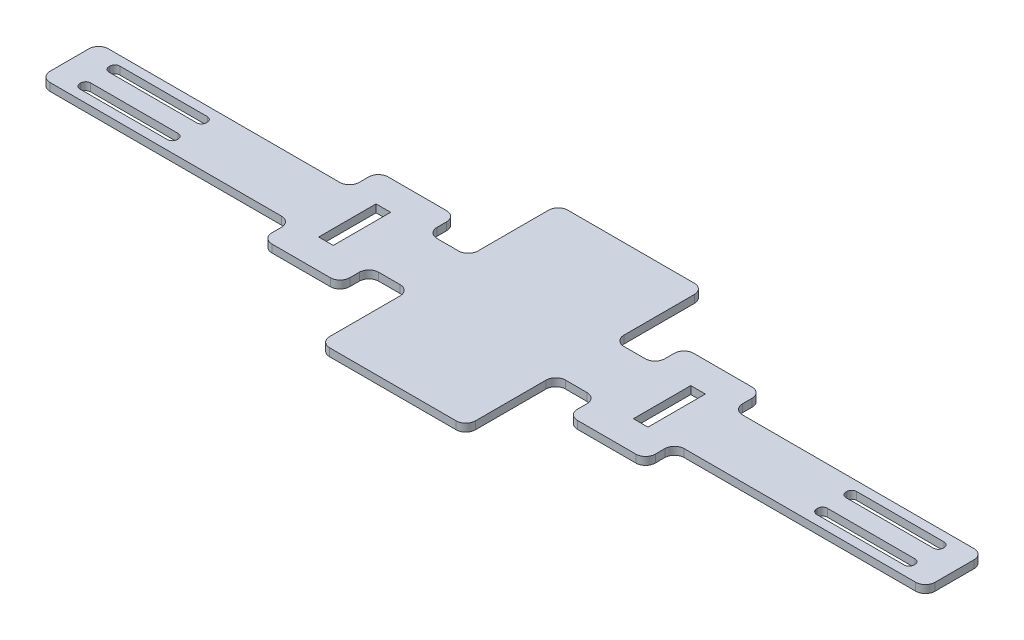
from build123d import *

# Parameters (mm, degrees)
SKETCH_11_W             = 70
SKETCH_11_H             = 12
EXTRUDE_6_DEPTH         = 1.6
SKETCH_12_W             = 3
SKETCH_12_H             = 11.8
CUT_EXTRUDE_6_DEPTH     = 1.6
SKETCH_13_W             = 20
SKETCH_13_H             = 2.2
CUT_EXTRUDE_7_DEPTH     = 1.6
FILLET_1_R              = 1
FILLET_1_OF_MIRROR_15_R = 1
EXTRUDE_7_DEPTH         = 1.6
SKETCH_16_W             = 6
SKETCH_16_H             = 12
EXTRUDE_9_DEPTH         = 1.6
SKETCH_18_W             = 30
SKETCH_18_H             = 49
EXTRUDE_12_DEPTH        = 1.6
FILLET_3_R              = 2
MIRROR_24_OUTLINE_W     = 3
MIRROR_24_OUTLINE_H     = 11.8
MIRROR_24_DEPTH         = 1.6
FILLET_4_R              = 2


# Read off the part's stored shape, not the designer's step: 镜向24
with BuildPart() as part:
    # 草图11 → 凸台-拉伸6 (new body)
    with BuildSketch(Plane(origin=(0, 0, 0), x_dir=(1, 0, 0), z_dir=(0, 1, 0))):
        with Locations((-92.991102456, 0)):
            Rectangle(SKETCH_11_W, SKETCH_11_H)
    extrude(amount=EXTRUDE_6_DEPTH)

    # 草图12 → 切除-拉伸6 (cut)
    with BuildSketch(Plane(origin=(0, 1.6, 0), x_dir=(1, 0, 0), z_dir=(0, 1, 0))):
        with Locations((-69.350034459, 0)):
            Rectangle(SKETCH_12_W, SKETCH_12_H)
    extrude(amount=-CUT_EXTRUDE_6_DEPTH, mode=Mode.SUBTRACT)

    # 草图13 → 切除-拉伸7 (cut)
    with BuildSketch(Plane(origin=(0, 1.6, 0), x_dir=(1, 0, 0), z_dir=(0, 1, 0))):
        with Locations((-112.744310304, 3)):
            Rectangle(SKETCH_13_W, SKETCH_13_H)
    cut_extrude_7 = extrude(amount=-CUT_EXTRUDE_7_DEPTH, mode=Mode.SUBTRACT)

    # 圆角1
    fillet_1_edges = [part.edges().sort_by_distance(p)[0] for p in [
        (-122.744310304, 0.8, -1.9),
        (-122.744310304, 0.8, -4.1),
        (-102.744310304, 0.8, -4.1),
        (-102.744310304, 0.8, -1.9),
    ]]
    fillet(fillet_1_edges, radius=FILLET_1_R)

    # 镜向15: 切除-拉伸7 across plane
    add(cut_extrude_7.mirror(Plane(origin=(0, 0, 0), x_dir=(1, 0, 0), z_dir=(0, 0, -1))), mode=Mode.SUBTRACT)

    # 圆角1 of 镜向15
    fillet_1_of_mirror_15_edges = [part.edges().sort_by_distance(p)[0] for p in [
        (-122.744310304, 0.8, 1.9),
        (-122.744310304, 0.8, 4.1),
        (-102.744310304, 0.8, 4.1),
        (-102.744310304, 0.8, 1.9),
    ]]
    fillet(fillet_1_of_mirror_15_edges, radius=FILLET_1_OF_MIRROR_15_R)

    # 草图14 → 凸台-拉伸7 (add)
    with BuildSketch(Plane(origin=(0, 0, 0), x_dir=(1, 0, 0), z_dir=(0, 1, 0))):
        Polygon((-60.400975616, 6), (-60.400975616, 11.948069584), (-62.610711949, 11.948069584), (-76.405563985, 11.948069584), (-76.405563985, 6), (-74.195827651, 6), (-62.609356584, 6), align=None)
    extrude_7 = extrude(amount=EXTRUDE_7_DEPTH)

    # 镜向17: 凸台-拉伸7 across plane
    add(extrude_7.mirror(Plane(origin=(0, 0, 0), x_dir=(1, 0, 0), z_dir=(0, 0, -1))))

    # 草图16 → 凸台-拉伸9 (add)
    with BuildSketch(Plane(origin=(0, 0, 0), x_dir=(1, 0, 0), z_dir=(0, 1, 0))):
        with Locations((-54.991102456, 0)):
            Rectangle(SKETCH_16_W, SKETCH_16_H)
    extrude(amount=EXTRUDE_9_DEPTH)

    # 草图18 → 凸台-拉伸12 (add)
    with BuildSketch(Plane(origin=(0, 0, 0), x_dir=(1, 0, 0), z_dir=(0, 1, 0))):
        with Locations((-36.991102456, 0)):
            Rectangle(SKETCH_18_W, SKETCH_18_H)
    extrude(amount=EXTRUDE_12_DEPTH)

    # 圆角3
    fillet_3_edges = [part.edges().sort_by_distance(p)[0] for p in [
        (-127.991102456, 0.8, 6),
        (-127.991102456, 0.8, -6),
        (-51.991102456, 0.8, -6),
        (-51.991102456, 0.8, 6),
        (-76.405563985, 0.8, 6),
        (-60.400975616, 0.8, 6),
        (-60.400975616, 0.8, -6),
        (-76.405563985, 0.8, -6),
        (-60.400975616, 0.8, 11.948069584),
        (-76.405563985, 0.8, 11.948069584),
        (-76.405563985, 0.8, -11.948069584),
        (-60.400975616, 0.8, -11.948069584),
    ]]
    fillet(fillet_3_edges, radius=FILLET_3_R)

    # 镜向24 outline → 镜向24 (add)
    with BuildSketch(Plane(origin=(0, 0, 0), x_dir=(1, 0, 0), z_dir=(0, 1, 0))):
        with BuildLine():
            Line((4.423359072, -6), (52.008897544, -6))
            ThreePointArc((52.008897544, -6), (53.423111106, -5.414213562), (54.008897544, -4))
            Line((54.008897544, -4), (54.008897544, 4))
            ThreePointArc((54.008897544, 4), (53.423111106, 5.414213562), (52.008897544, 6))
            Line((52.008897544, 6), (4.423359072, 6))
            ThreePointArc((4.423359072, 6), (3.00914551, 6.585786438), (2.423359072, 8))
            Line((2.423359072, 8), (2.423359072, 9.948069584))
            ThreePointArc((2.423359072, 9.948069584), (1.837572634, 11.362283146), (0.423359072, 11.948069584))
            Line((0.423359072, 11.948069584), (-11.581229297, 11.948069584))
            ThreePointArc((-11.581229297, 11.948069584), (-12.995442859, 11.362283146), (-13.581229297, 9.948069584))
            Line((-13.581229297, 9.948069584), (-13.581229297, 8))
            ThreePointArc((-13.581229297, 8), (-14.167015735, 6.585786438), (-15.581229297, 6))
            Line((-15.581229297, 6), (-19.991102456, 6))
            ThreePointArc((-19.991102456, 6), (-21.405316019, 6.585786437), (-21.991102456, 8))
            Line((-21.991102456, 8), (-21.991102456, -8))
            ThreePointArc((-21.991102456, -8), (-21.405316019, -6.585786437), (-19.991102456, -6))
            Line((-19.991102456, -6), (-15.581229297, -6))
            ThreePointArc((-15.581229297, -6), (-14.167015735, -6.585786438), (-13.581229297, -8))
            Line((-13.581229297, -8), (-13.581229297, -9.948069584))
            ThreePointArc((-13.581229297, -9.948069584), (-12.995442859, -11.362283146), (-11.581229297, -11.948069584))
            Line((-11.581229297, -11.948069584), (0.423359072, -11.948069584))
            ThreePointArc((0.423359072, -11.948069584), (1.837572634, -11.362283146), (2.423359072, -9.948069584))
            Line((2.423359072, -9.948069584), (2.423359072, -8))
            ThreePointArc((2.423359072, -8), (3.00914551, -6.585786438), (4.423359072, -6))
        make_face()
        with Locations((-4.632170453, 0)):
            Rectangle(MIRROR_24_OUTLINE_W, MIRROR_24_OUTLINE_H, mode=Mode.SUBTRACT)
        with BuildLine():
            ThreePointArc((28.762105391, -2.9), (29.05499861, -2.192893219), (29.762105391, -1.9))
            Line((29.762105391, -1.9), (47.762105391, -1.9))
            ThreePointArc((47.762105391, -1.9), (48.469212172, -2.192893219), (48.762105391, -2.9))
            Line((48.762105391, -2.9), (48.762105391, -3.1))
            ThreePointArc((48.762105391, -3.1), (48.469212172, -3.807106781), (47.762105391, -4.1))
            Line((47.762105391, -4.1), (29.762105391, -4.1))
            ThreePointArc((29.762105391, -4.1), (29.05499861, -3.807106781), (28.762105391, -3.1))
            Line((28.762105391, -3.1), (28.762105391, -2.9))
        make_face(mode=Mode.SUBTRACT)
        with BuildLine():
            Line((29.762105391, 4.1), (47.762105391, 4.1))
            ThreePointArc((47.762105391, 4.1), (48.469212172, 3.807106781), (48.762105391, 3.1))
            Line((48.762105391, 3.1), (48.762105391, 2.9))
            ThreePointArc((48.762105391, 2.9), (48.469212172, 2.192893219), (47.762105391, 1.9))
            Line((47.762105391, 1.9), (29.762105391, 1.9))
            ThreePointArc((29.762105391, 1.9), (29.05499861, 2.192893219), (28.762105391, 2.9))
            Line((28.762105391, 2.9), (28.762105391, 3.1))
            ThreePointArc((28.762105391, 3.1), (29.05499861, 3.807106781), (29.762105391, 4.1))
        make_face(mode=Mode.SUBTRACT)
    extrude(amount=MIRROR_24_DEPTH)

    # 圆角4
    fillet_4_edges = [part.edges().sort_by_distance(p)[0] for p in [
        (-21.991102456, 0.8, -24.5),
        (-51.991102456, 0.8, -24.5),
        (-51.991102456, 0.8, 24.5),
        (-21.991102456, 0.8, 24.5),
    ]]
    fillet(fillet_4_edges, radius=FILLET_4_R)


solid = part.part
